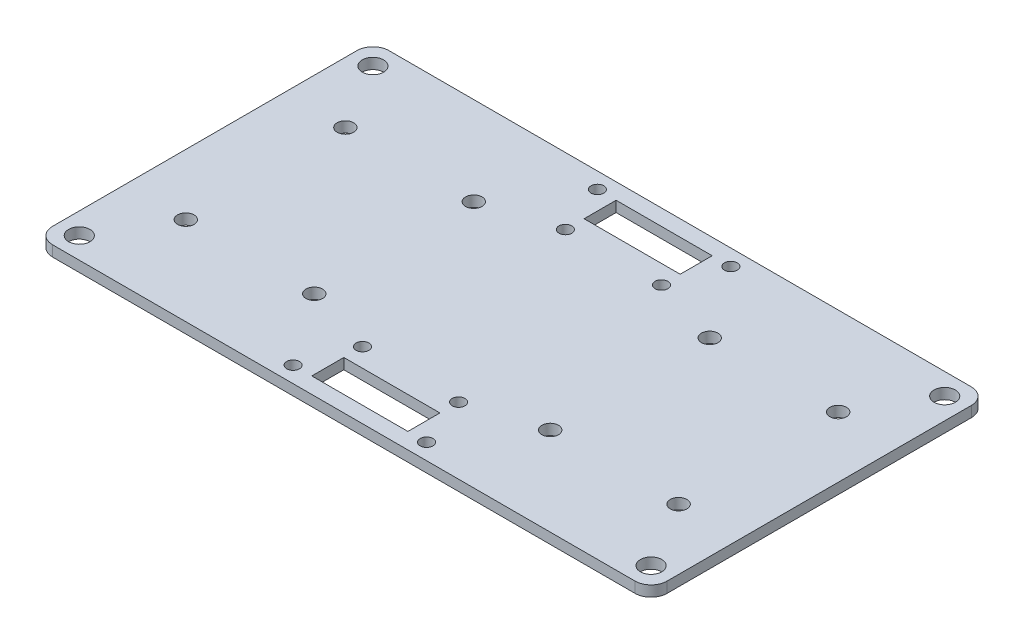
from build123d import *

# Parameters (mm, degrees)
ESBO_O1_W                = 115.09677689
ESBO_O1_H                = 63
RESSALTO_EXTRUS_O1_DEPTH = 2
ESBO_O2_R                = 1.55
CORTE_EXTRUS_O1_DEPTH    = 66.635866816
ESBO_O3_W                = 18
ESBO_O3_H                = 6
CORTE_EXTRUS_O2_DEPTH    = 66.635866816
ESBO_O5_R                = 2
CORTE_EXTRUS_O3_DEPTH    = 66.635866816
FILETE1_R                = 3
ESBO_O8_R                = 1.2
CORTE_EXTRUS_O4_DEPTH    = 66.635866816


with BuildPart() as part:
    # Esboço1 → Ressalto-extrusão1 (new body)
    with BuildSketch(Plane(origin=(0, 0, 0), x_dir=(1, 0, 0), z_dir=(0, 1, 0))):
        Rectangle(ESBO_O1_W, ESBO_O1_H)
    extrude(amount=RESSALTO_EXTRUS_O1_DEPTH)

    # Esboço2 → Corte-extrusão1 (cut, through all)
    with BuildSketch(Plane(origin=(0, 2, 0), x_dir=(1, 0, 0), z_dir=(0, 1, 0))):
        with Locations((-46.153556516, -14.945)):
            Circle(ESBO_O2_R)
        with Locations((-22.093556516, -14.94)):
            Circle(ESBO_O2_R)
        with Locations((22.093556516, -14.94)):
            Circle(ESBO_O2_R)
        with Locations((46.153556516, -14.945)):
            Circle(ESBO_O2_R)
        with Locations((46.153556516, 14.945)):
            Circle(ESBO_O2_R)
        with Locations((22.093556516, 14.94)):
            Circle(ESBO_O2_R)
        with Locations((-22.093556516, 14.94)):
            Circle(ESBO_O2_R)
        with Locations((-46.153556516, 14.945)):
            Circle(ESBO_O2_R)
    extrude(amount=-CORTE_EXTRUS_O1_DEPTH, mode=Mode.SUBTRACT)

    # Esboço3 → Corte-extrusão2 (cut, through all)
    with BuildSketch(Plane.XZ):
        with Locations((0, 25.5)):
            Rectangle(ESBO_O3_W, ESBO_O3_H)
        with Locations((0, -25.5)):
            Rectangle(ESBO_O3_W, ESBO_O3_H)
    extrude(amount=-CORTE_EXTRUS_O2_DEPTH, mode=Mode.SUBTRACT)

    # Esboço5 → Corte-extrusão3 (cut, through all)
    with BuildSketch(Plane(origin=(0, 2, 0), x_dir=(1, 0, 0), z_dir=(0, 1, 0))):
        with Locations((53.548388445, 27.5)):
            Circle(ESBO_O5_R)
        with Locations((53.548388445, -27.5)):
            Circle(ESBO_O5_R)
        with Locations((-53.548388445, -27.5)):
            Circle(ESBO_O5_R)
        with Locations((-53.548388445, 27.5)):
            Circle(ESBO_O5_R)
    extrude(amount=-CORTE_EXTRUS_O3_DEPTH, mode=Mode.SUBTRACT)

    # Filete1
    filete1_edges = [part.edges().sort_by_distance(p)[0] for p in [
        (57.548388445, 1, -31.5),
        (57.548388445, 1, 31.5),
        (-57.548388445, 1, 31.5),
        (-57.548388445, 1, -31.5),
    ]]
    fillet(filete1_edges, radius=FILETE1_R)

    # Esboço8 → Corte-extrusão4 (cut, through all)
    with BuildSketch(Plane(origin=(0, 2, 0), x_dir=(1, 0, 0), z_dir=(0, 1, 0))):
        with Locations((-12.498388445, 28.5)):
            Circle(ESBO_O8_R)
        with Locations((12.498388445, 28.5)):
            Circle(ESBO_O8_R)
        with Locations((12.498388445, -28.5)):
            Circle(ESBO_O8_R)
        with Locations((-12.498388445, -28.5)):
            Circle(ESBO_O8_R)
        with Locations((-8.998388445, -19)):
            Circle(ESBO_O8_R)
        with Locations((8.998388445, -19)):
            Circle(ESBO_O8_R)
        with Locations((8.998388445, 19)):
            Circle(ESBO_O8_R)
        with Locations((-8.998388445, 19)):
            Circle(ESBO_O8_R)
    extrude(amount=-CORTE_EXTRUS_O4_DEPTH, mode=Mode.SUBTRACT)


solid = part.part
